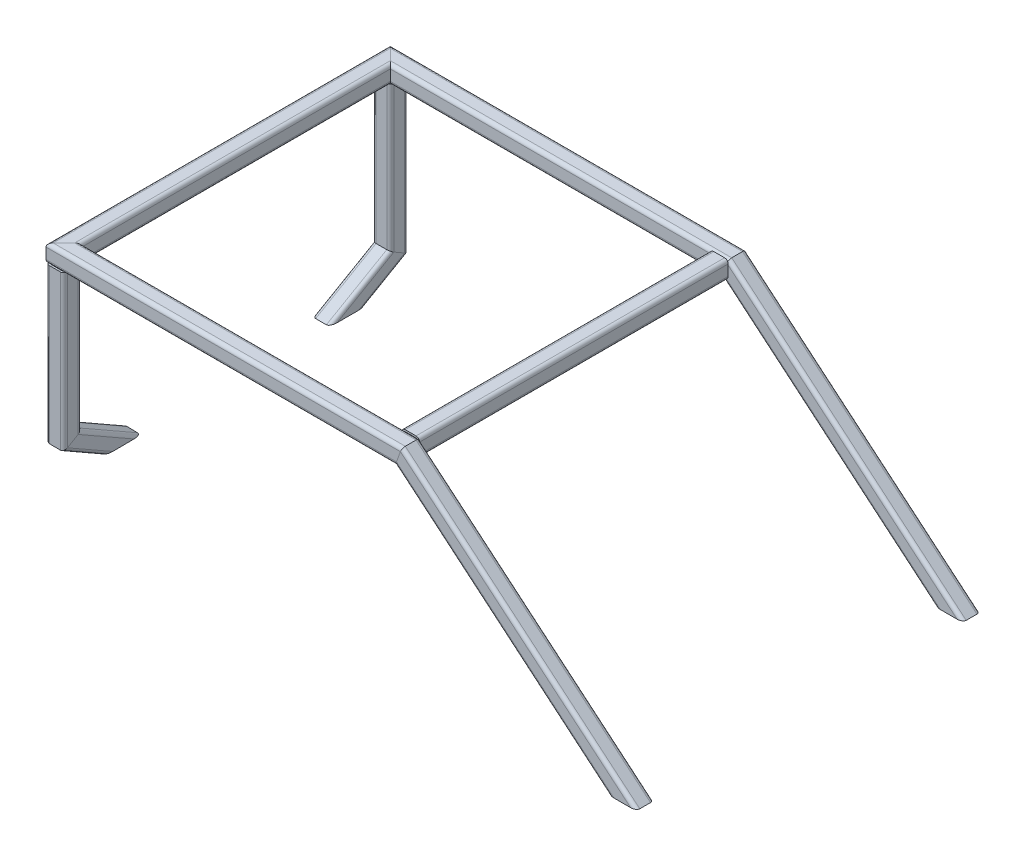
from build123d import *

# Parameters (mm, degrees)
SQUARE_START                           = 290.590307815
SQUARE_TUBE_20_X_20_X_2_1_DEPTH        = 368.639702343
SQUARE_START_2                         = 353
SQUARE_TUBE_20_X_20_X_2_1_2_OUTLINE_W  = 25
SQUARE_TUBE_20_X_20_X_2_1_2_OUTLINE_H  = 23
SQUARE_TUBE_20_X_20_X_2_1_2_DEPTH      = 7.926538718
SQUARE_START_3                         = -10
SQUARE_TUBE_20_X_20_X_2_1_3_DEPTH      = 397.729702343
SQUARE_START_4                         = -74
SQUARE_TUBE_20_X_20_X_2_1_4_DEPTH      = 151.476735566
SQUARE_START_5                         = -192.5
SQUARE_TUBE_20_X_20_X_2_1_5_DEPTH      = 385
SQUARE_START_6                         = 129.046987567
SQUARE_TUBE_20_X_20_X_2_1_6_OUTLINE_W  = 274.046987567
SQUARE_TUBE_20_X_20_X_2_1_6_OUTLINE_H  = 22
SQUARE_TUBE_20_X_20_X_2_1_6_DEPTH      = 14.953012433
SQUARE_START_7                         = -144
SQUARE_TUBE_20_X_20_X_2_1_7_OUTLINE_W  = 15.953012433
SQUARE_TUBE_20_X_20_X_2_1_7_OUTLINE_H  = 22
SQUARE_TUBE_20_X_20_X_2_1_7_DEPTH      = 273.046987567
SQUARE_TUBE_20_X_20_X_2_1_8_DEPTH      = 397.729702343
SQUARE_START_8                         = -73.357205596
SQUARE_TUBE_20_X_20_X_2_1_9_DEPTH      = 150.833941162
SQUARE_TUBE_20_X_20_X_2_1_10_DEPTH     = 368.639702343
SQUARE_TUBE_20_X_20_X_2_1_11_OUTLINE_W = 25
SQUARE_TUBE_20_X_20_X_2_1_11_OUTLINE_H = 23
SQUARE_TUBE_20_X_20_X_2_1_11_DEPTH     = 7.926538718
SQUARE_START_9                         = -172.5
SQUARE_TUBE_20_X_20_X_2_1_12_DEPTH     = 345
SQUARE_TUBE_20_X_20_X_2_2_DEPTH        = 185.964965809
SQUARE_TUBE_20_X_20_X_2_2_2_DEPTH      = 99.164965809
SQUARE_TUBE_20_X_20_X_2_2_3_DEPTH      = 185.964965809
SQUARE_TUBE_20_X_20_X_2_2_4_DEPTH      = 99.164965809
SKETCH112_W                            = 705.419438986
SKETCH112_H                            = 411.314902242
CUT_EXTRUDE1_DEPTH                     = 50


with BuildPart() as part:
    # Square tube 20 X 20 X 2(1): read off the stored shape, not the designer's step
    # Square tube 20 X 20 X 2(1) outline → Square tube 20 X 20 X 2(1) (new body)
    with BuildSketch(Plane(origin=(0, 0, 0), x_dir=(0.6427876096865404, 0.7660444431189772, 0), z_dir=(0.7660444431189772, -0.6427876096865403, 0)).offset(SQUARE_START)):
        with BuildLine():
            Line((256.888293005, -188.5), (256.888293005, -176.5))
            ThreePointArc((256.888293005, -176.5), (255.71672013, -173.671572876), (252.888293005, -172.5))
            Line((252.888293005, -172.5), (240.888293005, -172.5))
            ThreePointArc((240.888293005, -172.5), (238.05986588, -173.671572875), (236.888293005, -176.5))
            Line((236.888293005, -176.5), (236.888293005, -188.5))
            ThreePointArc((236.888293005, -188.5), (238.05986588, -191.328427125), (240.888293005, -192.5))
            Line((240.888293005, -192.5), (252.888293005, -192.5))
            ThreePointArc((252.888293005, -192.5), (255.71672013, -191.328427124), (256.888293005, -188.5))
        make_face()
        with BuildLine():
            ThreePointArc((254.888293005, -188.5), (254.302506567, -189.914213562), (252.888293005, -190.5))
            Line((252.888293005, -190.5), (240.888293005, -190.5))
            ThreePointArc((240.888293005, -190.5), (239.474079442, -189.914213562), (238.888293005, -188.5))
            Line((238.888293005, -188.5), (238.888293005, -176.5))
            ThreePointArc((238.888293005, -176.5), (239.474079442, -175.085786438), (240.888293005, -174.5))
            Line((240.888293005, -174.5), (252.888293005, -174.5))
            ThreePointArc((252.888293005, -174.5), (254.302506567, -175.085786438), (254.888293005, -176.5))
            Line((254.888293005, -176.5), (254.888293005, -188.5))
        make_face(mode=Mode.SUBTRACT)
    extrude(amount=SQUARE_TUBE_20_X_20_X_2_1_DEPTH)

    # Square tube 20 X 20 X 2_1 2 outline → Square tube 20 X 20 X 2_1 2 (cut)
    with BuildSketch(Plane(origin=(0, 0, 0), x_dir=(0.3420201433256691, 0.9396926207859082, 0), z_dir=(0.9396926207859083, -0.3420201433256691, 0)).offset(SQUARE_START_2)):
        with Locations((131.5, -182.5)):
            Rectangle(SQUARE_TUBE_20_X_20_X_2_1_2_OUTLINE_W, SQUARE_TUBE_20_X_20_X_2_1_2_OUTLINE_H)
    extrude(amount=SQUARE_TUBE_20_X_20_X_2_1_2_DEPTH, mode=Mode.SUBTRACT)


with BuildPart() as body_2:
    # Square tube 20 X 20 X 2_1 3 outline → Square tube 20 X 20 X 2_1 3 (new body)
    with BuildSketch(Plane.YZ.offset(SQUARE_START_3)):
        with BuildLine():
            Line((10, -188.5), (10, -176.5))
            ThreePointArc((10, -176.5), (8.828427125, -173.671572875), (6, -172.5))
            Line((6, -172.5), (-6, -172.5))
            ThreePointArc((-6, -172.5), (-8.828427125, -173.671572875), (-10, -176.5))
            Line((-10, -176.5), (-10, -188.5))
            ThreePointArc((-10, -188.5), (-8.828427125, -191.328427125), (-6, -192.5))
            Line((-6, -192.5), (6, -192.5))
            ThreePointArc((6, -192.5), (8.828427125, -191.328427125), (10, -188.5))
        make_face()
        with BuildLine():
            ThreePointArc((8, -188.5), (7.414213562, -189.914213562), (6, -190.5))
            Line((6, -190.5), (-6, -190.5))
            ThreePointArc((-6, -190.5), (-7.414213562, -189.914213562), (-8, -188.5))
            Line((-8, -188.5), (-8, -176.5))
            ThreePointArc((-8, -176.5), (-7.414213562, -175.085786438), (-6, -174.5))
            Line((-6, -174.5), (6, -174.5))
            ThreePointArc((6, -174.5), (7.414213562, -175.085786438), (8, -176.5))
            Line((8, -176.5), (8, -188.5))
        make_face(mode=Mode.SUBTRACT)
    extrude(amount=SQUARE_TUBE_20_X_20_X_2_1_3_DEPTH)

    # Square tube 20 X 20 X 2_1 4 outline → Square tube 20 X 20 X 2_1 4 (cut)
    with BuildSketch(Plane(origin=(0, 0, 0), x_dir=(0.9461886483394651, -0.3040991697893314, -0.11068304606838086), z_dir=(0.32361557711818495, 0.889126490715988, 0.3236155771181854)).offset(SQUARE_START_4)):
        Polygon((30.593790503, 159.803626709), (9.805521312, 183.184179878), (8.191027539, 185), (5, 185), (5, 158), (32.197442789, 158), align=None)
        Polygon((392, 185), (385.212088862, 185), (384.998209879, 183.184179878), (382.244297817, 159.803626709), (382.031855053, 158), (392, 158), align=None)
    extrude(amount=SQUARE_TUBE_20_X_20_X_2_1_4_DEPTH, mode=Mode.SUBTRACT)


with BuildPart() as body_3:
    # Square tube 20 X 20 X 2_1 5 outline → Square tube 20 X 20 X 2_1 5 (new body)
    with BuildSketch(Plane.XY.offset(SQUARE_START_5)):
        with BuildLine():
            ThreePointArc((10, 6), (8.828427125, 8.828427125), (6, 10))
            Line((6, 10), (-6, 10))
            ThreePointArc((-6, 10), (-8.828427125, 8.828427125), (-10, 6))
            Line((-10, 6), (-10, -6))
            ThreePointArc((-10, -6), (-8.828427125, -8.828427125), (-6, -10))
            Line((-6, -10), (6, -10))
            ThreePointArc((6, -10), (8.828427125, -8.828427125), (10, -6))
            Line((10, -6), (10, 6))
        make_face()
        with BuildLine():
            Line((-8, -6), (-8, 6))
            ThreePointArc((-8, 6), (-7.414213562, 7.414213562), (-6, 8))
            Line((-6, 8), (6, 8))
            ThreePointArc((6, 8), (7.414213562, 7.414213562), (8, 6))
            Line((8, 6), (8, -6))
            ThreePointArc((8, -6), (7.414213562, -7.414213562), (6, -8))
            Line((6, -8), (-6, -8))
            ThreePointArc((-6, -8), (-7.414213562, -7.414213562), (-8, -6))
        make_face(mode=Mode.SUBTRACT)
    extrude(amount=SQUARE_TUBE_20_X_20_X_2_1_5_DEPTH)

    # Square tube 20 X 20 X 2_1 6 outline → Square tube 20 X 20 X 2_1 6 (cut)
    with BuildSketch(Plane(origin=(0, 0, 0), x_dir=(0.707106781186548, 0, -0.707106781186547), z_dir=(0.707106781186547, 0, 0.707106781186548)).offset(SQUARE_START_6)):
        with Locations((-7.976506216, 0)):
            Rectangle(SQUARE_TUBE_20_X_20_X_2_1_6_OUTLINE_W, SQUARE_TUBE_20_X_20_X_2_1_6_OUTLINE_H)
    extrude(amount=SQUARE_TUBE_20_X_20_X_2_1_6_DEPTH, mode=Mode.SUBTRACT)

    # Square tube 20 X 20 X 2_1 7 outline → Square tube 20 X 20 X 2_1 7 (cut)
    with BuildSketch(Plane(origin=(0, 0, 0), x_dir=(0.707106781186548, 0, -0.707106781186547), z_dir=(0.707106781186547, 0, 0.707106781186548)).offset(SQUARE_START_7)):
        with Locations((137.023493783, 0)):
            Rectangle(SQUARE_TUBE_20_X_20_X_2_1_7_OUTLINE_W, SQUARE_TUBE_20_X_20_X_2_1_7_OUTLINE_H)
    extrude(amount=SQUARE_TUBE_20_X_20_X_2_1_7_DEPTH, mode=Mode.SUBTRACT)


with BuildPart() as body_4:
    # Square tube 20 X 20 X 2_1 8 outline → Square tube 20 X 20 X 2_1 8 (new body)
    with BuildSketch(Plane.YZ.offset(SQUARE_START_3)):
        with BuildLine():
            ThreePointArc((6, 172.5), (8.828427125, 173.671572875), (10, 176.5))
            Line((10, 176.5), (10, 188.5))
            ThreePointArc((10, 188.5), (8.828427125, 191.328427125), (6, 192.5))
            Line((6, 192.5), (-6, 192.5))
            ThreePointArc((-6, 192.5), (-8.828427125, 191.328427125), (-10, 188.5))
            Line((-10, 188.5), (-10, 176.5))
            ThreePointArc((-10, 176.5), (-8.828427125, 173.671572875), (-6, 172.5))
            Line((-6, 172.5), (6, 172.5))
        make_face()
        with BuildLine():
            Line((-6, 190.5), (6, 190.5))
            ThreePointArc((6, 190.5), (7.414213562, 189.914213562), (8, 188.5))
            Line((8, 188.5), (8, 176.5))
            ThreePointArc((8, 176.5), (7.414213562, 175.085786438), (6, 174.5))
            Line((6, 174.5), (-6, 174.5))
            ThreePointArc((-6, 174.5), (-7.414213562, 175.085786438), (-8, 176.5))
            Line((-8, 176.5), (-8, 188.5))
            ThreePointArc((-8, 188.5), (-7.414213562, 189.914213562), (-6, 190.5))
        make_face(mode=Mode.SUBTRACT)
    extrude(amount=SQUARE_TUBE_20_X_20_X_2_1_8_DEPTH)

    # Square tube 20 X 20 X 2_1 9 outline → Square tube 20 X 20 X 2_1 9 (cut)
    with BuildSketch(Plane(origin=(0, 0, 0), x_dir=(0.9461886483394651, -0.3040991697893314, 0.11068304606838086), z_dir=(0.32361557711818495, 0.889126490715988, -0.3236155771181854)).offset(SQUARE_START_8)):
        Polygon((382.244297817, -159.803626709), (384.998209879, -183.184179878), (385.212088862, -185), (392, -185), (392, -158), (382.031855053, -158), align=None)
        Polygon((5, -185), (8.191027539, -185), (9.805521312, -183.184179878), (30.593790503, -159.803626709), (32.197442789, -158), (5, -158), align=None)
    extrude(amount=SQUARE_TUBE_20_X_20_X_2_1_9_DEPTH, mode=Mode.SUBTRACT)


with BuildPart() as body_5:
    # Square tube 20 X 20 X 2_1 10 outline → Square tube 20 X 20 X 2_1 10 (new body)
    with BuildSketch(Plane(origin=(0, 0, 0), x_dir=(0.6427876096865404, 0.7660444431189772, 0), z_dir=(0.7660444431189772, -0.6427876096865403, 0)).offset(SQUARE_START)):
        with BuildLine():
            ThreePointArc((252.888293005, 172.5), (255.71672013, 173.671572876), (256.888293005, 176.5))
            Line((256.888293005, 176.5), (256.888293005, 188.5))
            ThreePointArc((256.888293005, 188.5), (255.71672013, 191.328427124), (252.888293005, 192.5))
            Line((252.888293005, 192.5), (240.888293005, 192.5))
            ThreePointArc((240.888293005, 192.5), (238.05986588, 191.328427125), (236.888293005, 188.5))
            Line((236.888293005, 188.5), (236.888293005, 176.5))
            ThreePointArc((236.888293005, 176.5), (238.05986588, 173.671572875), (240.888293005, 172.5))
            Line((240.888293005, 172.5), (252.888293005, 172.5))
        make_face()
        with BuildLine():
            Line((240.888293005, 190.5), (252.888293005, 190.5))
            ThreePointArc((252.888293005, 190.5), (254.302506567, 189.914213562), (254.888293005, 188.5))
            Line((254.888293005, 188.5), (254.888293005, 176.5))
            ThreePointArc((254.888293005, 176.5), (254.302506567, 175.085786438), (252.888293005, 174.5))
            Line((252.888293005, 174.5), (240.888293005, 174.5))
            ThreePointArc((240.888293005, 174.5), (239.474079442, 175.085786438), (238.888293005, 176.5))
            Line((238.888293005, 176.5), (238.888293005, 188.5))
            ThreePointArc((238.888293005, 188.5), (239.474079442, 189.914213562), (240.888293005, 190.5))
        make_face(mode=Mode.SUBTRACT)
    extrude(amount=SQUARE_TUBE_20_X_20_X_2_1_10_DEPTH)

    # Square tube 20 X 20 X 2_1 11 outline → Square tube 20 X 20 X 2_1 11 (cut)
    with BuildSketch(Plane(origin=(0, 0, 0), x_dir=(0.3420201433256691, 0.9396926207859082, 0), z_dir=(0.9396926207859083, -0.3420201433256691, 0)).offset(SQUARE_START_2)):
        with Locations((131.5, 182.5)):
            Rectangle(SQUARE_TUBE_20_X_20_X_2_1_11_OUTLINE_W, SQUARE_TUBE_20_X_20_X_2_1_11_OUTLINE_H)
    extrude(amount=SQUARE_TUBE_20_X_20_X_2_1_11_DEPTH, mode=Mode.SUBTRACT)


with BuildPart() as body_6:
    # Square tube 20 X 20 X 2_1 12 outline → Square tube 20 X 20 X 2_1 12 (new body)
    with BuildSketch(Plane.XY.offset(SQUARE_START_9)):
        with BuildLine():
            ThreePointArc((387.73, 6), (386.558427125, 8.828427125), (383.73, 10))
            Line((383.73, 10), (371.73, 10))
            ThreePointArc((371.73, 10), (368.901572875, 8.828427125), (367.73, 6))
            Line((367.73, 6), (367.73, -6))
            ThreePointArc((367.73, -6), (368.901572875, -8.828427125), (371.73, -10))
            Line((371.73, -10), (383.73, -10))
            ThreePointArc((383.73, -10), (386.558427125, -8.828427125), (387.73, -6))
            Line((387.73, -6), (387.73, 6))
        make_face()
        with BuildLine():
            Line((369.73, -6), (369.73, 6))
            ThreePointArc((369.73, 6), (370.315786438, 7.414213562), (371.73, 8))
            Line((371.73, 8), (383.73, 8))
            ThreePointArc((383.73, 8), (385.144213562, 7.414213562), (385.73, 6))
            Line((385.73, 6), (385.73, -6))
            ThreePointArc((385.73, -6), (385.144213562, -7.414213562), (383.73, -8))
            Line((383.73, -8), (371.73, -8))
            ThreePointArc((371.73, -8), (370.315786438, -7.414213562), (369.73, -6))
        make_face(mode=Mode.SUBTRACT)
    extrude(amount=SQUARE_TUBE_20_X_20_X_2_1_12_DEPTH)


with BuildPart() as body_7:
    # Sketch1 → Square tube 20 X 20 X 2(2) (new body)
    with BuildSketch(Plane(origin=(0, 0, -182.5), x_dir=(1, 0, 0), z_dir=(0, -1, 0))):
        with BuildLine():
            Line((-6, -10), (6, -10))
            ThreePointArc((6, -10), (8.828427125, -8.828427125), (10, -6))
            Line((10, -6), (10, 6))
            ThreePointArc((10, 6), (8.828427125, 8.828427125), (6, 10))
            Line((6, 10), (-6, 10))
            ThreePointArc((-6, 10), (-8.828427125, 8.828427125), (-10, 6))
            Line((-10, 6), (-10, -6))
            ThreePointArc((-10, -6), (-8.828427125, -8.828427125), (-6, -10))
        make_face()
        with BuildLine():
            Line((-6, -8), (6, -8))
            ThreePointArc((6, -8), (7.414213562, -7.414213562), (8, -6))
            Line((8, -6), (8, 6))
            ThreePointArc((8, 6), (7.414213562, 7.414213562), (6, 8))
            Line((6, 8), (-6, 8))
            ThreePointArc((-6, 8), (-7.414213562, 7.414213562), (-8, 6))
            Line((-8, 6), (-8, -6))
            ThreePointArc((-8, -6), (-7.414213562, -7.414213562), (-6, -8))
        make_face(mode=Mode.SUBTRACT)
    extrude(amount=SQUARE_TUBE_20_X_20_X_2_2_DEPTH)

    # Square tube 20 X 20 X 2(2) mitre 1
    split(bisect_by=Plane(origin=(0, -176.8, -182.5), x_dir=(-1.0, -7.6e-08, 0), z_dir=(-6.6e-08, 0.866025404, -0.5)), keep=Keep.TOP)

    # Trim/Extend2
    split(bisect_by=Plane(origin=(-0.065753425, -10, 0), x_dir=(1, 0, 0), z_dir=(0, -1, 0)), keep=Keep.TOP)


with BuildPart() as body_8:
    # Sketch1 on segment 2 (carried to segment 2) → Square tube 20 X 20 X 2_2 2 (new body)
    with BuildSketch(Plane(origin=(-1.051e-06, -172.217517095, -190.437093216), x_dir=(1.0, 1.15e-07, -6.6e-08), z_dir=(1.15e-07, -0.5, 0.866025404))):
        with BuildLine():
            Line((-6, -10), (6, -10))
            ThreePointArc((6, -10), (8.828427125, -8.828427125), (10, -6))
            Line((10, -6), (10, 6))
            ThreePointArc((10, 6), (8.828427125, 8.828427125), (6, 10))
            Line((6, 10), (-6, 10))
            ThreePointArc((-6, 10), (-8.828427125, 8.828427125), (-10, 6))
            Line((-10, 6), (-10, -6))
            ThreePointArc((-10, -6), (-8.828427125, -8.828427125), (-6, -10))
        make_face()
        with BuildLine():
            Line((-6, -8), (6, -8))
            ThreePointArc((6, -8), (7.414213562, -7.414213562), (8, -6))
            Line((8, -6), (8, 6))
            ThreePointArc((8, 6), (7.414213562, 7.414213562), (6, 8))
            Line((6, 8), (-6, 8))
            ThreePointArc((-6, 8), (-7.414213562, 7.414213562), (-8, 6))
            Line((-8, 6), (-8, -6))
            ThreePointArc((-8, -6), (-7.414213562, -7.414213562), (-6, -8))
        make_face(mode=Mode.SUBTRACT)
    extrude(amount=SQUARE_TUBE_20_X_20_X_2_2_2_DEPTH)

    # Square tube 20 X 20 X 2_2 2 mitre 1
    split(bisect_by=Plane(origin=(0, -176.8, -182.5), x_dir=(1.0, 7.6e-08, 0), z_dir=(6.6e-08, -0.866025404, 0.5)), keep=Keep.TOP)


with BuildPart() as body_9:
    # Sketch1 on segment 3 (carried to segment 3) → Square tube 20 X 20 X 2_2 3 (new body)
    with BuildSketch(Plane(origin=(0, 0, 182.5), x_dir=(1, 0, 0), z_dir=(0, -1, 0))):
        with BuildLine():
            Line((-6, -10), (6, -10))
            ThreePointArc((6, -10), (8.828427125, -8.828427125), (10, -6))
            Line((10, -6), (10, 6))
            ThreePointArc((10, 6), (8.828427125, 8.828427125), (6, 10))
            Line((6, 10), (-6, 10))
            ThreePointArc((-6, 10), (-8.828427125, 8.828427125), (-10, 6))
            Line((-10, 6), (-10, -6))
            ThreePointArc((-10, -6), (-8.828427125, -8.828427125), (-6, -10))
        make_face()
        with BuildLine():
            Line((-6, -8), (6, -8))
            ThreePointArc((6, -8), (7.414213562, -7.414213562), (8, -6))
            Line((8, -6), (8, 6))
            ThreePointArc((8, 6), (7.414213562, 7.414213562), (6, 8))
            Line((6, 8), (-6, 8))
            ThreePointArc((-6, 8), (-7.414213562, 7.414213562), (-8, 6))
            Line((-8, 6), (-8, -6))
            ThreePointArc((-8, -6), (-7.414213562, -7.414213562), (-6, -8))
        make_face(mode=Mode.SUBTRACT)
    extrude(amount=SQUARE_TUBE_20_X_20_X_2_2_3_DEPTH)

    # Square tube 20 X 20 X 2_2 3 mitre 1
    split(bisect_by=Plane(origin=(0, -176.8, 182.5), x_dir=(-0.999961484, 0.008776657, 0), z_dir=(0.0076011, 0.866025404, 0.49994222)), keep=Keep.TOP)

    # Trim/Extend2
    split(bisect_by=Plane(origin=(-0.065753425, -10, 0), x_dir=(1, 0, 0), z_dir=(0, -1, 0)), keep=Keep.TOP)


with BuildPart() as body_10:
    # Sketch1 on segment 4 (carried to segment 4) → Square tube 20 X 20 X 2_2 4 (new body)
    with BuildSketch(Plane(origin=(0.120661283, -172.217517095, 190.436176004), x_dir=(0.999884447, -0.013165492, -0.007600222), z_dir=(-0.013165492, -0.5, -0.865925326))):
        with BuildLine():
            Line((-6, -10), (6, -10))
            ThreePointArc((6, -10), (8.828427125, -8.828427125), (10, -6))
            Line((10, -6), (10, 6))
            ThreePointArc((10, 6), (8.828427125, 8.828427125), (6, 10))
            Line((6, 10), (-6, 10))
            ThreePointArc((-6, 10), (-8.828427125, 8.828427125), (-10, 6))
            Line((-10, 6), (-10, -6))
            ThreePointArc((-10, -6), (-8.828427125, -8.828427125), (-6, -10))
        make_face()
        with BuildLine():
            Line((-6, -8), (6, -8))
            ThreePointArc((6, -8), (7.414213562, -7.414213562), (8, -6))
            Line((8, -6), (8, 6))
            ThreePointArc((8, 6), (7.414213562, 7.414213562), (6, 8))
            Line((6, 8), (-6, 8))
            ThreePointArc((-6, 8), (-7.414213562, 7.414213562), (-8, 6))
            Line((-8, 6), (-8, -6))
            ThreePointArc((-8, -6), (-7.414213562, -7.414213562), (-6, -8))
        make_face(mode=Mode.SUBTRACT)
    extrude(amount=SQUARE_TUBE_20_X_20_X_2_2_4_DEPTH)

    # Square tube 20 X 20 X 2_2 4 mitre 1
    split(bisect_by=Plane(origin=(0, -176.8, 182.5), x_dir=(0.999961484, -0.008776657, 0), z_dir=(-0.0076011, -0.866025404, -0.49994222)), keep=Keep.TOP)


with BuildPart() as cut_extrude1_tool:
    # Sketch112 → Cut-Extrude1 (new body)
    with BuildSketch(Plane(origin=(0, -210, 0), x_dir=(1, 0, 0), z_dir=(0, 1, 0))):
        with Locations((339.623740402, -2.775441668)):
            Rectangle(SKETCH112_W, SKETCH112_H)
    extrude(amount=-CUT_EXTRUDE1_DEPTH)


with BuildPart() as part_1:
    add(part.part)

    # Cut-Extrude1: cut by cut_extrude1_tool
    add(cut_extrude1_tool.part, mode=Mode.SUBTRACT)


with BuildPart() as body_5_1:
    add(body_5.part)

    # Cut-Extrude1: cut by cut_extrude1_tool
    add(cut_extrude1_tool.part, mode=Mode.SUBTRACT)


with BuildPart() as body_8_1:
    add(body_8.part)

    # Cut-Extrude1: cut by cut_extrude1_tool
    add(cut_extrude1_tool.part, mode=Mode.SUBTRACT)


with BuildPart() as body_10_1:
    add(body_10.part)

    # Cut-Extrude1: cut by cut_extrude1_tool
    add(cut_extrude1_tool.part, mode=Mode.SUBTRACT)


solid = Compound([body_2.part, body_3.part, body_4.part, body_6.part, body_7.part, body_9.part, part_1.part, body_5_1.part, body_8_1.part, body_10_1.part])
